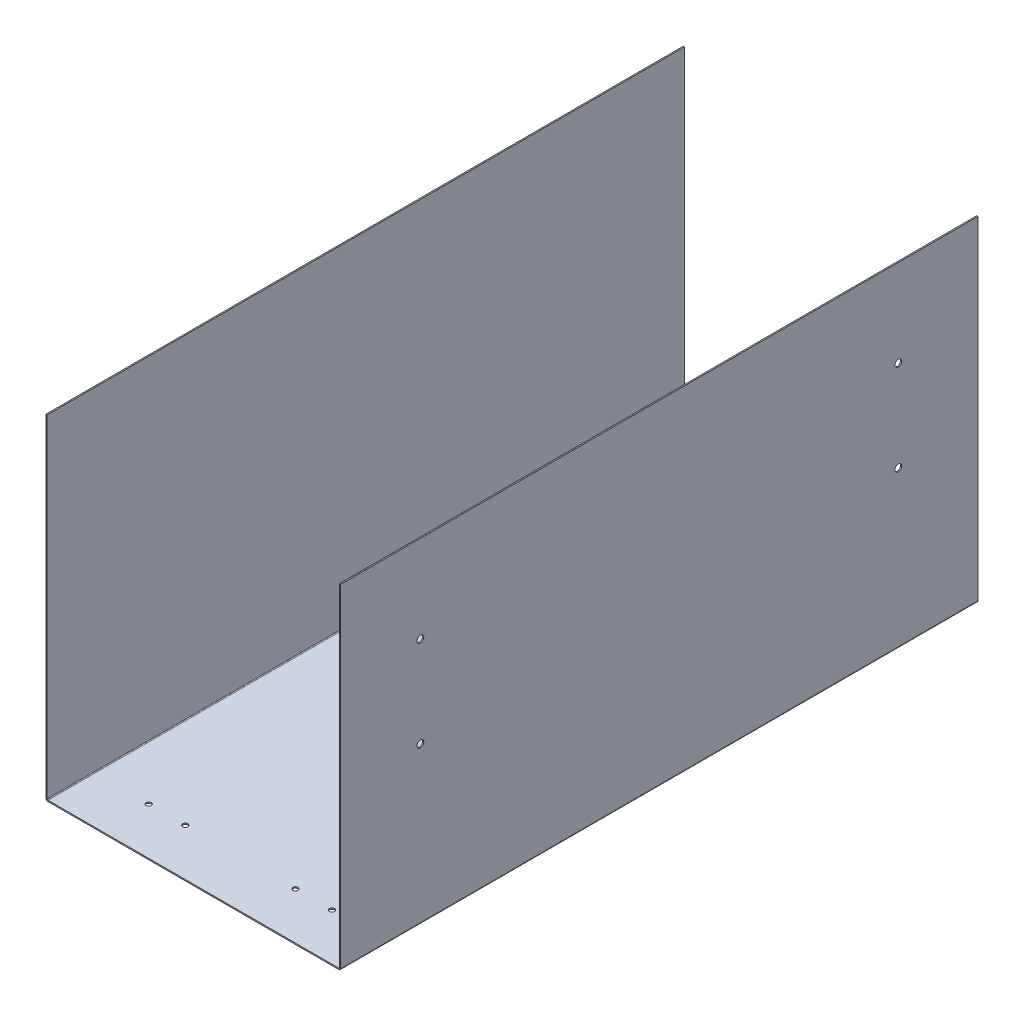
from build123d import *

# Parameters (mm, degrees)
TABAN_FLAN_1_DEPTH    = 400
IZIM6_R               = 3.25
KES_EKSTR_ZYON1_DEPTH = 10
IZIM7_R               = 4.25
KES_EKSTR_ZYON2_DEPTH = 10


# Sheet-metal steps are written as plain solids
with BuildPart() as part:
    # Çizim1 → Taban-Flanş1 (new, symmetric)
    with BuildSketch(Plane.XY):
        with BuildLine():
            Line((-185, 420), (-185, 2.5))
            ThreePointArc((-185, 2.5), (-184.267766953, 0.732233047), (-182.5, 0))
            Line((-182.5, 0), (182.5, 0))
            ThreePointArc((182.5, 0), (184.267766953, 0.732233047), (185, 2.5))
            Line((185, 2.5), (185, 420))
            Line((185, 420), (183.5, 420))
            Line((183.5, 420), (183.5, 2.5))
            ThreePointArc((183.5, 2.5), (183.207106781, 1.792893219), (182.5, 1.5))
            Line((182.5, 1.5), (-182.5, 1.5))
            ThreePointArc((-182.5, 1.5), (-183.207106781, 1.792893219), (-183.5, 2.5))
            Line((-183.5, 2.5), (-183.5, 420))
            Line((-183.5, 420), (-185, 420))
        make_face()
    extrude(amount=TABAN_FLAN_1_DEPTH, both=True)

    # Çizim6 → Kes-Ekstrüzyon1 (cut)
    with BuildSketch(Plane.XZ):
        with Locations((-115.125314072, 341)):
            Circle(IZIM6_R)
        with Locations((-69.125314072, 341)):
            Circle(IZIM6_R)
        with Locations((69.125314072, 341)):
            Circle(IZIM6_R)
        with Locations((115.125314072, 341)):
            Circle(IZIM6_R)
        with Locations((115.125314072, -341)):
            Circle(IZIM6_R)
        with Locations((69.125314072, -341)):
            Circle(IZIM6_R)
        with Locations((-69.125314072, -341)):
            Circle(IZIM6_R)
        with Locations((-115.125314072, -341)):
            Circle(IZIM6_R)
    extrude(amount=-KES_EKSTR_ZYON1_DEPTH, mode=Mode.SUBTRACT)

    # Çizim7 → Kes-Ekstrüzyon2 (cut)
    with BuildSketch(Plane(origin=(185, 0, 0), x_dir=(0, 0, -1), z_dir=(1, 0, 0))):
        with Locations(Location((-300, 310.5, 0), (0, 0, 90))):
            Circle(IZIM7_R)
        with Locations(Location((-300, 196.5, 0), (0, 0, 90))):
            Circle(IZIM7_R)
        with Locations(Location((300, 196.5, 0), (0, 0, 90))):
            Circle(IZIM7_R)
        with Locations(Location((300, 310.5, 0), (0, 0, 90))):
            Circle(IZIM7_R)
    extrude(amount=-KES_EKSTR_ZYON2_DEPTH, mode=Mode.SUBTRACT)


solid = part.part
